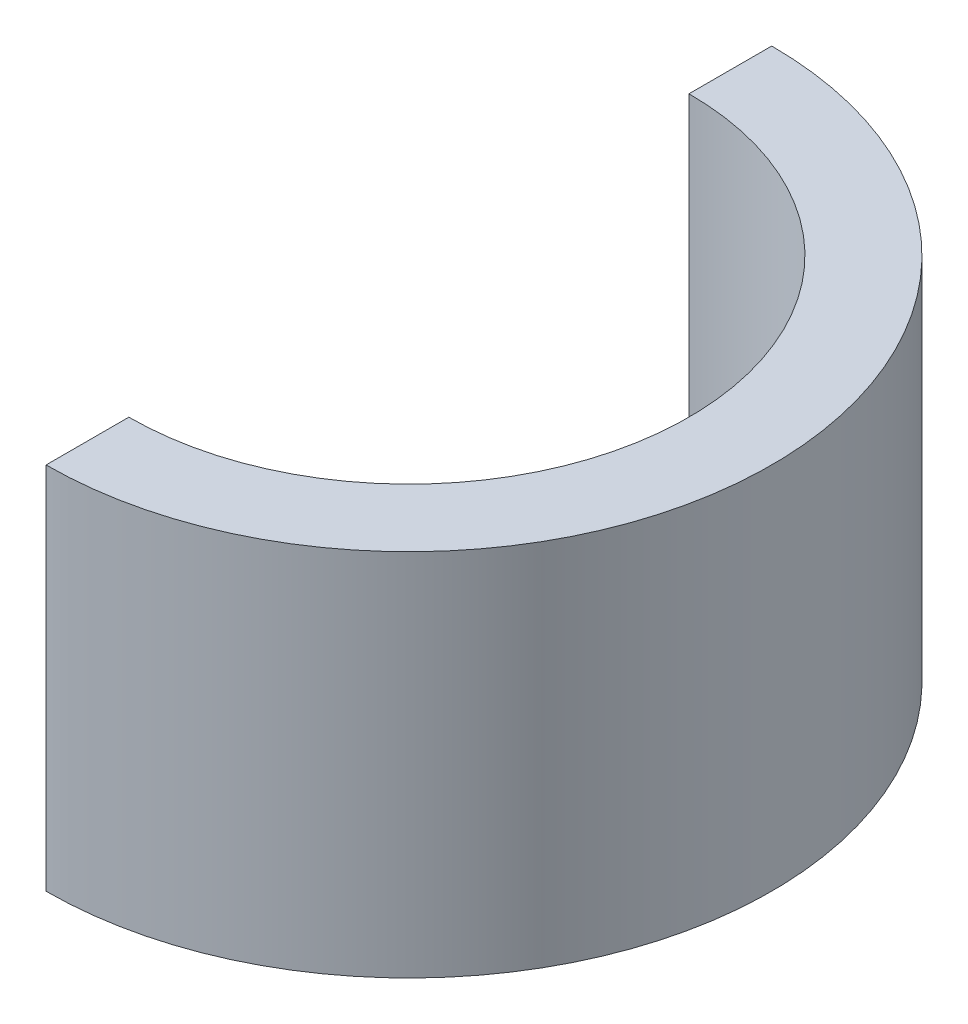
from build123d import *

# Parameters (mm, degrees)
SKETCH1_R                = 28.5
SKETCH1_R_2              = 22
BOSS_EXTRUDE1_DEPTH      = 29
SPLIT1_SURFACE_1_BACK    = 86.668
SPLIT1_SURFACE_1_DEPTH   = 173.336
SPLIT1_SURFACE_2_BACK    = 86.668
SPLIT1_SURFACE_2_DEPTH   = 173.336
BODY_DELETE_KEEP_1_DEPTH = 29


# Read off the part's stored shape, not the designer's step: Body-Delete/Keep 1
with BuildPart() as part:
    # Sketch1 → Boss-Extrude1 (new body)
    with BuildSketch(Plane(origin=(0, 0, 0), x_dir=(1, 0, 0), z_dir=(0, 1, 0))):
        with Locations(Location((0, 0, 0), (0, 0, 270))):
            Circle(SKETCH1_R)
        with Locations(Location((0, 0, 0), (0, 0, 270))):
            Circle(SKETCH1_R_2, mode=Mode.SUBTRACT)
    extrude(amount=BOSS_EXTRUDE1_DEPTH)


with BuildPart() as body_2:
    # Split1: the piece behind the surface
    add(part.part)
    # Split1 surface: a surface, the sketch's curves swept straight by 173.336 mm
    with BuildLine(Plane.XY.offset(-SPLIT1_SURFACE_1_BACK), mode=Mode.PRIVATE) as split1_surface_1_path:
        Line((0, 33.955759062), (0, -6.102624859))
    split1_surface_1 = Shell.extrude(split1_surface_1_path.wire(), (0 * SPLIT1_SURFACE_1_DEPTH, 0 * SPLIT1_SURFACE_1_DEPTH, 1 * SPLIT1_SURFACE_1_DEPTH))
    split(bisect_by=split1_surface_1, keep=Keep.BOTTOM)

    # Body-Delete/Keep 1 outline → Body-Delete/Keep 1 (cut)
    with BuildSketch(Plane(origin=(0, 0, 0), x_dir=(1, 0, 0), z_dir=(0, 1, 0))):
        with BuildLine():
            Line((0, -28.5), (0, -22))
            ThreePointArc((0, -22), (-22, 0), (0, 22))
            Line((0, 22), (0, 28.5))
            ThreePointArc((0, 28.5), (-28.5, 0), (0, -28.5))
        make_face()
    extrude(amount=BODY_DELETE_KEEP_1_DEPTH, mode=Mode.SUBTRACT)


with BuildPart() as part_1:
    add(part.part)

    # Split1: split by a surface, the side it looks to stays
    # Split1 surface: a surface, the sketch's curves swept straight by 173.336 mm
    with BuildLine(Plane.XY.offset(-SPLIT1_SURFACE_2_BACK), mode=Mode.PRIVATE) as split1_surface_2_path:
        Line((0, 33.955759062), (0, -6.102624859))
    split1_surface_2 = Shell.extrude(split1_surface_2_path.wire(), (0 * SPLIT1_SURFACE_2_DEPTH, 0 * SPLIT1_SURFACE_2_DEPTH, 1 * SPLIT1_SURFACE_2_DEPTH))
    split(bisect_by=split1_surface_2, keep=Keep.TOP)


solid = part_1.part
